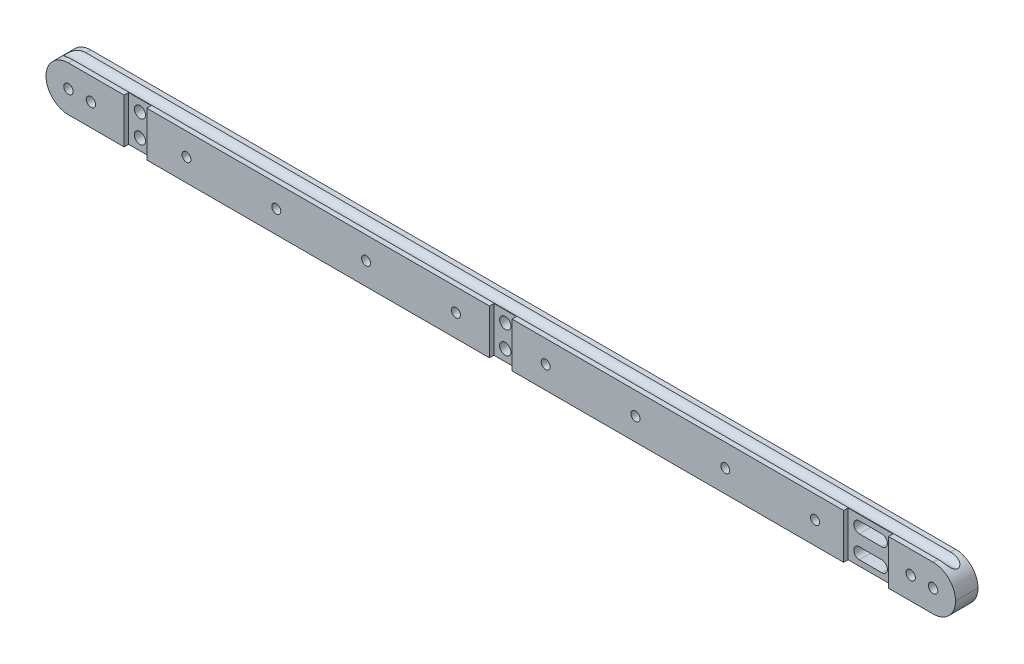
from build123d import *

# Parameters (mm, degrees)
ESQUISSE1_R             = 2.5
ESQUISSE1_R_2           = 2
BOSS_EXTRU_1_DEPTH      = 10
CONG_1_R                = 10
TROU_TARAUD_M5X0_81_D   = 4.2
ESQUISSE5_W             = 10.1
ESQUISSE5_H             = 20
ESQUISSE5_W_2           = 20
ENL_V_MAT_EXTRU_1_DEPTH = 2
ESQUISSE6_R             = 3
ENL_V_MAT_EXTRU_3_DEPTH = 406.766586229


with BuildPart() as part:
    # Esquisse1 → Boss.-Extru.1 (new body)
    with BuildSketch(Plane.XY):
        Polygon((0, 20), (0, 0), (60, 0), (385.15, 0), (405.15, 0), (405.15, 20), (385.15, 20), (60, 20), align=None)
        with Locations((202.575, 15)):
            Circle(ESQUISSE1_R, mode=Mode.SUBTRACT)
        with Locations((202.575, 5)):
            Circle(ESQUISSE1_R, mode=Mode.SUBTRACT)
        with Locations((39.85, 5)):
            Circle(ESQUISSE1_R, mode=Mode.SUBTRACT)
        with Locations((39.85, 15)):
            Circle(ESQUISSE1_R, mode=Mode.SUBTRACT)
        with Locations((222.575, 10)):
            Circle(ESQUISSE1_R_2, mode=Mode.SUBTRACT)
        with Locations((262.575, 10)):
            Circle(ESQUISSE1_R_2, mode=Mode.SUBTRACT)
        with Locations((302.575, 10)):
            Circle(ESQUISSE1_R_2, mode=Mode.SUBTRACT)
        with Locations((342.575, 10)):
            Circle(ESQUISSE1_R_2, mode=Mode.SUBTRACT)
        with Locations((182.575, 10)):
            Circle(ESQUISSE1_R_2, mode=Mode.SUBTRACT)
        with Locations((142.575, 10)):
            Circle(ESQUISSE1_R_2, mode=Mode.SUBTRACT)
        with Locations((102.575, 10)):
            Circle(ESQUISSE1_R_2, mode=Mode.SUBTRACT)
        with Locations((62.575, 10)):
            Circle(ESQUISSE1_R_2, mode=Mode.SUBTRACT)
        with BuildLine():
            Line((360.3, 17.5), (370.3, 17.5))
            ThreePointArc((370.3, 17.5), (372.8, 15), (370.3, 12.5))
            Line((370.3, 12.5), (360.3, 12.5))
            ThreePointArc((360.3, 12.5), (357.8, 15), (360.3, 17.5))
        make_face(mode=Mode.SUBTRACT)
        with BuildLine():
            Line((360.3, 2.5), (370.3, 2.5))
            ThreePointArc((370.3, 2.5), (372.8, 5), (370.3, 7.5))
            Line((370.3, 7.5), (360.3, 7.5))
            ThreePointArc((360.3, 7.5), (357.8, 5), (360.3, 2.5))
        make_face(mode=Mode.SUBTRACT)
    extrude(amount=BOSS_EXTRU_1_DEPTH)

    # Congé1
    cong_1_edges = [part.edges().sort_by_distance(p)[0] for p in [
        (0, 0, 5),
        (0, 20, 5),
        (405.15, 0, 5),
        (405.15, 20, 5),
    ]]
    fillet(cong_1_edges, radius=CONG_1_R - 0.0001)  # a hair under: the kernel refuses the full size

    # Trou taraudé M5x0.81 (through all)
    with Locations(Plane.XY.offset(10)):
        with Locations((385.15, 10), (395.15, 10), (10, 10), (20, 10)):
            Hole(TROU_TARAUD_M5X0_81_D / 2)

    # Esquisse5 → Enlèv. mat.-Extru.1 (cut)
    with BuildSketch(Plane.XY.offset(10)):
        with Locations((202.575, 10)):
            Rectangle(ESQUISSE5_W, ESQUISSE5_H)
        with Locations((365.3, 10)):
            Rectangle(ESQUISSE5_W_2, ESQUISSE5_H)
        with Locations((39.85, 10)):
            Rectangle(ESQUISSE5_W, ESQUISSE5_H)
    extrude(amount=-ENL_V_MAT_EXTRU_1_DEPTH, mode=Mode.SUBTRACT)

    # Esquisse6 → Enlèv. mat.-Extru.3 (cut, through all)
    with BuildSketch(Plane(origin=(0, 0, 0), x_dir=(0, 0, -1), z_dir=(1, 0, 0))):
        with Locations((-5, 21)):
            Circle(ESQUISSE6_R)
    extrude(amount=ENL_V_MAT_EXTRU_3_DEPTH, mode=Mode.SUBTRACT)


solid = part.part
